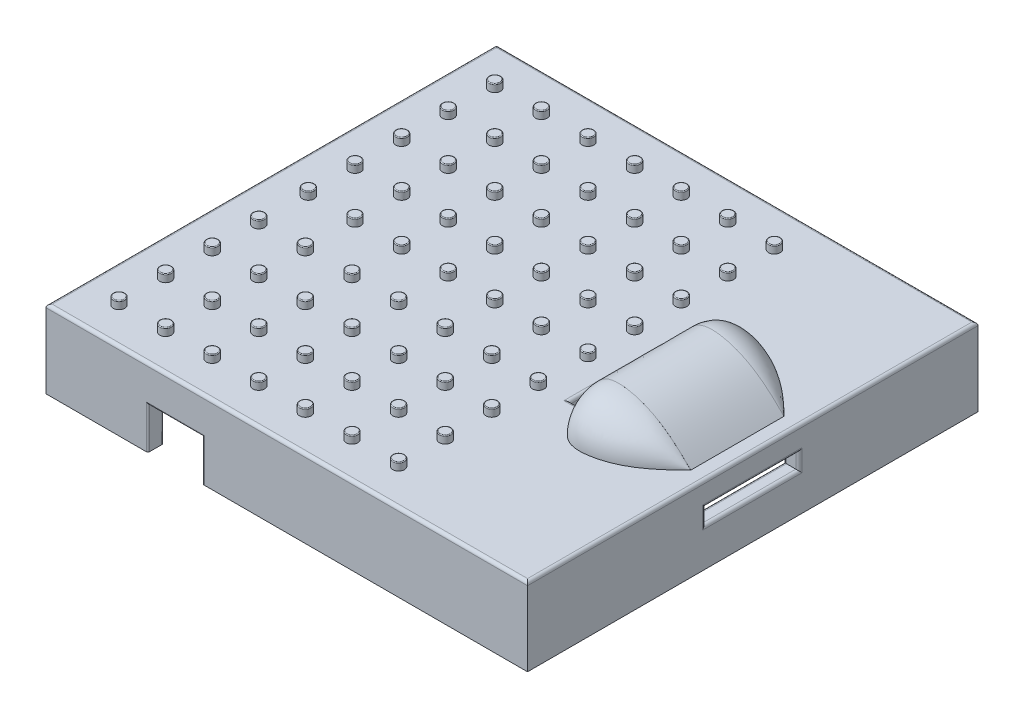
from build123d import *

# Parameters (mm, degrees)
SKETCH1_W           = 310
SKETCH1_H           = 290
BOSS_EXTRUDE1_DEPTH = 50
CUT_EXTRUDE3_DEPTH  = 40
BOSS_EXTRUDE3_START = -30
BOSS_EXTRUDE3_DEPTH = 60
REVOLVE9_ANGLE      = 90
REVOLVE10_ANGLE     = 90
SKETCH18_R          = 3.745
BOSS_EXTRUDE4_DEPTH = 4.9
FILLET3_R           = 0.5
FILLET9_R           = 2
CUT_EXTRUDE9_DEPTH  = 10
FILLET14_R          = 2
CUT_EXTRUDE10_DEPTH = 10
FILLET15_R          = 2
CUT_EXTRUDE11_START = -145
SKETCH21_W          = 35.224793961
SKETCH21_H          = 26.773914636
CUT_EXTRUDE11_DEPTH = 290
FILLET17_R          = 1


with BuildPart() as part:
    # Sketch1 → Boss-Extrude1 (new body)
    with BuildSketch(Plane(origin=(0, 0, 0), x_dir=(1, 0, 0), z_dir=(0, 1, 0))):
        Rectangle(SKETCH1_W, SKETCH1_H)
    extrude(amount=-BOSS_EXTRUDE1_DEPTH)

    # 3DSketch1 → Cut-Extrude3 (cut)
    with BuildSketch(Plane(origin=(145, -50, -135), x_dir=(-0.7318939744313497, 0, 0.6814185279188429), z_dir=(0, 1, 0))):
        Polygon((0, 0), (212.249252585, -197.611373096), (396.232255123, 0), (183.983002538, 197.611373096), align=None)
    extrude(amount=CUT_EXTRUDE3_DEPTH, mode=Mode.SUBTRACT)

    # Sketch3 → Boss-Extrude3 (add)
    with BuildSketch(Plane.XY.offset(BOSS_EXTRUDE3_START)):
        with BuildLine():
            Line((77.586962215, 0), (145.086962215, 0))
            add(Edge.make_bspline(
                [(77.586962215, 0), (84.732827695, 42.270472868), (108.196356269, 16.1555996), (113.544446998, 32.608859531), (145.086962215, 0)],
                knots=[0, 0, 0, 0, 0, 1, 1, 1, 1, 1], degree=4))
        make_face()
    extrude(amount=BOSS_EXTRUDE3_DEPTH)

    # Sketch16 → Revolve9 (revolve)
    with BuildSketch(Plane.XY.offset(30)):
        with BuildLine():
            Line((77.5, 0), (145, 0))
            add(Edge.make_bspline(
                [(77.5, 0), (84.732827695, 42.270472868), (108.196356269, 16.1555996), (113.544446998, 32.608859531), (145, 0)],
                knots=[0, 0, 0, 0, 0, 1, 1, 1, 1, 1], degree=4))
        make_face()
    revolve(axis=Axis((77.586962215, 0, 30), (1, 0, 0)), revolution_arc=REVOLVE9_ANGLE)

    # Sketch17 → Revolve10 (revolve)
    with BuildSketch(Plane.XY.offset(-30)):
        with BuildLine():
            Line((77.5, 0), (145, 0))
            add(Edge.make_bspline(
                [(77.5, 0), (84.732827695, 42.270472868), (108.196356269, 16.1555996), (113.544446998, 32.608859531), (145, 0)],
                knots=[0, 0, 0, 0, 0, 1, 1, 1, 1, 1], degree=4))
        make_face()
    revolve(axis=Axis((77.586962215, 0, -30), (-1, 0, 0)), revolution_arc=REVOLVE10_ANGLE)

    # Sketch18 → Boss-Extrude4 (add)
    with BuildSketch(Plane(origin=(0, 0, 0), x_dir=(1, 0, 0), z_dir=(0, 1, 0))):
        with Locations(Location((-131.067130765, 90, 0), (0, 0, 90))):
            Circle(SKETCH18_R)
        with Locations(Location((-131.067130765, 60, 0), (0, 0, 90))):
            Circle(SKETCH18_R)
        with Locations(Location((-131.067130765, 30, 0), (0, 0, 90))):
            Circle(SKETCH18_R)
        with Locations(Location((-131.067130765, 0, 0), (0, 0, 90))):
            Circle(SKETCH18_R)
        with Locations(Location((-131.067130765, -31.933169579, 0), (0, 0, 90))):
            Circle(SKETCH18_R)
        with Locations(Location((-131.067130765, -61.933169579, 0), (0, 0, 90))):
            Circle(SKETCH18_R)
        with Locations(Location((-131.067130765, -91.933169579, 0), (0, 0, 90))):
            Circle(SKETCH18_R)
        with Locations(Location((-101.067130765, 90, 0), (0, 0, 90))):
            Circle(SKETCH18_R)
        with Locations(Location((-101.067130765, 60, 0), (0, 0, 90))):
            Circle(SKETCH18_R)
        with Locations(Location((-101.067130765, 30, 0), (0, 0, 90))):
            Circle(SKETCH18_R)
        with Locations(Location((-101.067130765, 0, 0), (0, 0, 90))):
            Circle(SKETCH18_R)
        with Locations(Location((-101.067130765, -31.933169579, 0), (0, 0, 90))):
            Circle(SKETCH18_R)
        with Locations(Location((-101.067130765, -61.933169579, 0), (0, 0, 90))):
            Circle(SKETCH18_R)
        with Locations(Location((-101.067130765, -91.933169579, 0), (0, 0, 90))):
            Circle(SKETCH18_R)
        with Locations(Location((-71.067130765, 90, 0), (0, 0, 90))):
            Circle(SKETCH18_R)
        with Locations(Location((-71.067130765, 60, 0), (0, 0, 90))):
            Circle(SKETCH18_R)
        with Locations(Location((-71.067130765, 30, 0), (0, 0, 90))):
            Circle(SKETCH18_R)
        with Locations(Location((-71.067130765, 0, 0), (0, 0, 90))):
            Circle(SKETCH18_R)
        with Locations(Location((-71.067130765, -31.933169579, 0), (0, 0, 90))):
            Circle(SKETCH18_R)
        with Locations(Location((-71.067130765, -61.933169579, 0), (0, 0, 90))):
            Circle(SKETCH18_R)
        with Locations(Location((-71.067130765, -91.933169579, 0), (0, 0, 90))):
            Circle(SKETCH18_R)
        with Locations(Location((-41.067130765, 90, 0), (0, 0, 90))):
            Circle(SKETCH18_R)
        with Locations(Location((-41.067130765, 60, 0), (0, 0, 90))):
            Circle(SKETCH18_R)
        with Locations(Location((-41.067130765, 30, 0), (0, 0, 90))):
            Circle(SKETCH18_R)
        with Locations(Location((-41.067130765, 0, 0), (0, 0, 90))):
            Circle(SKETCH18_R)
        with Locations(Location((-41.067130765, -31.933169579, 0), (0, 0, 90))):
            Circle(SKETCH18_R)
        with Locations(Location((-41.067130765, -61.933169579, 0), (0, 0, 90))):
            Circle(SKETCH18_R)
        with Locations(Location((-41.067130765, -91.933169579, 0), (0, 0, 90))):
            Circle(SKETCH18_R)
        with Locations(Location((48.932869235, 90, 0), (0, 0, 90))):
            Circle(SKETCH18_R)
        with Locations(Location((48.932869235, 60, 0), (0, 0, 90))):
            Circle(SKETCH18_R)
        with Locations(Location((48.932869235, 30, 0), (0, 0, 90))):
            Circle(SKETCH18_R)
        with Locations(Location((-11.067130765, 90, 0), (0, 0, 90))):
            Circle(SKETCH18_R)
        with Locations(Location((-11.067130765, 60, 0), (0, 0, 90))):
            Circle(SKETCH18_R)
        with Locations(Location((-11.067130765, 30, 0), (0, 0, 90))):
            Circle(SKETCH18_R)
        with Locations(Location((-11.067130765, 0, 0), (0, 0, 90))):
            Circle(SKETCH18_R)
        with Locations(Location((-11.067130765, -31.933169579, 0), (0, 0, 90))):
            Circle(SKETCH18_R)
        with Locations(Location((-11.067130765, -61.933169579, 0), (0, 0, 90))):
            Circle(SKETCH18_R)
        with Locations(Location((-11.067130765, -91.933169579, 0), (0, 0, 90))):
            Circle(SKETCH18_R)
        with Locations(Location((48.932869235, 0, 0), (0, 0, 90))):
            Circle(SKETCH18_R)
        with Locations(Location((48.932869235, -31.933169579, 0), (0, 0, 90))):
            Circle(SKETCH18_R)
        with Locations(Location((48.932869235, -61.933169579, 0), (0, 0, 90))):
            Circle(SKETCH18_R)
        with Locations(Location((48.932869235, -91.933169579, 0), (0, 0, 90))):
            Circle(SKETCH18_R)
        with Locations(Location((18.932869235, 90, 0), (0, 0, 90))):
            Circle(SKETCH18_R)
        with Locations(Location((18.932869235, 60, 0), (0, 0, 90))):
            Circle(SKETCH18_R)
        with Locations(Location((18.932869235, 30, 0), (0, 0, 90))):
            Circle(SKETCH18_R)
        with Locations(Location((18.932869235, 0, 0), (0, 0, 90))):
            Circle(SKETCH18_R)
        with Locations(Location((18.932869235, -31.933169579, 0), (0, 0, 90))):
            Circle(SKETCH18_R)
        with Locations(Location((18.932869235, -61.933169579, 0), (0, 0, 90))):
            Circle(SKETCH18_R)
        with Locations(Location((18.932869235, -91.933169579, 0), (0, 0, 90))):
            Circle(SKETCH18_R)
        with Locations(Location((-131.067130765, 120, 0), (0, 0, 90))):
            Circle(SKETCH18_R)
        with Locations(Location((-101.067130765, 120, 0), (0, 0, 90))):
            Circle(SKETCH18_R)
        with Locations(Location((-71.067130765, 120, 0), (0, 0, 90))):
            Circle(SKETCH18_R)
        with Locations(Location((-41.067130765, 120, 0), (0, 0, 90))):
            Circle(SKETCH18_R)
        with Locations(Location((48.932869235, 120, 0), (0, 0, 90))):
            Circle(SKETCH18_R)
        with Locations(Location((-11.067130765, 120, 0), (0, 0, 90))):
            Circle(SKETCH18_R)
        with Locations(Location((18.932869235, 120, 0), (0, 0, 90))):
            Circle(SKETCH18_R)
        with Locations(Location((-131.067130765, -121.933169579, 0), (0, 0, 90))):
            Circle(SKETCH18_R)
        with Locations(Location((-101.067130765, -121.933169579, 0), (0, 0, 90))):
            Circle(SKETCH18_R)
        with Locations(Location((-71.067130765, -121.933169579, 0), (0, 0, 90))):
            Circle(SKETCH18_R)
        with Locations(Location((-41.067130765, -121.933169579, 0), (0, 0, 90))):
            Circle(SKETCH18_R)
        with Locations(Location((48.932869235, -121.933169579, 0), (0, 0, 90))):
            Circle(SKETCH18_R)
        with Locations(Location((-11.067130765, -121.933169579, 0), (0, 0, 90))):
            Circle(SKETCH18_R)
        with Locations(Location((18.932869235, -121.933169579, 0), (0, 0, 90))):
            Circle(SKETCH18_R)
    extrude(amount=BOSS_EXTRUDE4_DEPTH)

    # Fillet3
    fillet3_edges = [part.edges().sort_by_distance(p)[0] for p in [
        (-131.067130765, 4.9, -86.255),
        (-131.067130765, 4.9, -56.255),
        (-131.067130765, 4.9, -26.255),
        (-131.067130765, 4.9, 3.745),
        (-131.067130765, 4.9, 35.678169579),
        (-131.067130765, 4.9, 65.678169579),
        (-131.067130765, 4.9, 95.678169579),
        (-101.067130765, 4.9, -86.255),
        (-101.067130765, 4.9, -56.255),
        (-101.067130765, 4.9, -26.255),
        (-101.067130765, 4.9, 3.745),
        (-101.067130765, 4.9, 35.678169579),
        (-101.067130765, 4.9, 65.678169579),
        (-101.067130765, 4.9, 95.678169579),
        (-71.067130765, 4.9, -86.255),
        (-71.067130765, 4.9, -56.255),
        (-71.067130765, 4.9, -26.255),
        (-71.067130765, 4.9, 3.745),
        (-71.067130765, 4.9, 35.678169579),
        (-71.067130765, 4.9, 65.678169579),
        (-71.067130765, 4.9, 95.678169579),
        (-41.067130765, 4.9, -86.255),
        (-41.067130765, 4.9, -56.255),
        (-41.067130765, 4.9, -26.255),
        (-41.067130765, 4.9, 3.745),
        (-41.067130765, 4.9, 35.678169579),
        (-41.067130765, 4.9, 65.678169579),
        (-41.067130765, 4.9, 95.678169579),
        (48.932869235, 4.9, -86.255),
        (48.932869235, 4.9, -56.255),
        (48.932869235, 4.9, -26.255),
        (-11.067130765, 4.9, -86.255),
        (-11.067130765, 4.9, -56.255),
        (-11.067130765, 4.9, -26.255),
        (-11.067130765, 4.9, 3.745),
        (-11.067130765, 4.9, 35.678169579),
        (-11.067130765, 4.9, 65.678169579),
        (-11.067130765, 4.9, 95.678169579),
        (48.932869235, 4.9, 3.745),
        (48.932869235, 4.9, 35.678169579),
        (48.932869235, 4.9, 65.678169579),
        (48.932869235, 4.9, 95.678169579),
        (18.932869235, 4.9, -86.255),
        (18.932869235, 4.9, -56.255),
        (18.932869235, 4.9, -26.255),
        (18.932869235, 4.9, 3.745),
        (18.932869235, 4.9, 35.678169579),
        (18.932869235, 4.9, 65.678169579),
        (18.932869235, 4.9, 95.678169579),
        (-131.067130765, 4.9, -116.255),
        (-101.067130765, 4.9, -116.255),
        (-71.067130765, 4.9, -116.255),
        (-41.067130765, 4.9, -116.255),
        (48.932869235, 4.9, -116.255),
        (-11.067130765, 4.9, -116.255),
        (18.932869235, 4.9, -116.255),
        (-131.067130765, 4.9, 125.678169579),
        (-101.067130765, 4.9, 125.678169579),
        (-71.067130765, 4.9, 125.678169579),
        (-41.067130765, 4.9, 125.678169579),
        (48.932869235, 4.9, 125.678169579),
        (-11.067130765, 4.9, 125.678169579),
        (18.932869235, 4.9, 125.678169579),
    ]]
    fillet(fillet3_edges, radius=FILLET3_R)

    # Fillet9
    fillet9_edges = [part.edges().sort_by_distance(p)[0] for p in [
        (0, 0, 145),
        (-155, 0, 0),
        (0, 0, -145),
        (155, 0, 0),
    ]]
    fillet(fillet9_edges, radius=FILLET9_R)

    # Sketch20 → Cut-Extrude9 (cut)
    with BuildSketch(Plane(origin=(0, 0, 0), x_dir=(1, 0, 0), z_dir=(0, 1, 0))):
        Polygon((77.5, 30), (67.5, 30), (67.5, -30.127847173), (77.5, -30), align=None)
    extrude(amount=-CUT_EXTRUDE9_DEPTH, mode=Mode.SUBTRACT)

    # Fillet14
    # the kernel refuses this fillet: 2 mm, written as the material it takes off along each edge
    with BuildSketch(Plane(origin=(77.5, -10, 35), x_dir=(0, 1, 0), z_dir=(0, 0, -1))) as fillet14_piece_1_section:
        with BuildLine():
            CenterArc((FILLET14_R, FILLET14_R), FILLET14_R, 180, 90)
            Line((0, FILLET14_R), (-FILLET14_R * 0.02, FILLET14_R))
            Line((-FILLET14_R * 0.02, FILLET14_R), (-FILLET14_R * 0.02, -FILLET14_R * 0.02))
            Line((-FILLET14_R * 0.02, -FILLET14_R * 0.02), (FILLET14_R, -FILLET14_R * 0.02))
            Line((FILLET14_R, -FILLET14_R * 0.02), (FILLET14_R, 0))
        make_face()
    fillet14_piece_1 = extrude(amount=65, mode=Mode.PRIVATE)
    fillet14_piece_1 = split(fillet14_piece_1, bisect_by=Plane(origin=(78.336192456, -9.547186367, 29.989309516), z_dir=(-0.012783672553535347, 0, -0.9999182855193939)), keep=Keep.TOP, mode=Mode.PRIVATE)
    add(fillet14_piece_1, mode=Mode.SUBTRACT)
    with BuildSketch(Plane(origin=(62.500408572, -10, 30.191765535), x_dir=(0, 1, 0), z_dir=(0.9999182855193939, 0, -0.012783672553535347))) as fillet14_piece_2_section:
        with BuildLine():
            CenterArc((FILLET14_R, FILLET14_R), FILLET14_R, 180, 90)
            Line((0, FILLET14_R), (-FILLET14_R * 0.02, FILLET14_R))
            Line((-FILLET14_R * 0.02, FILLET14_R), (-FILLET14_R * 0.02, -FILLET14_R * 0.02))
            Line((-FILLET14_R * 0.02, -FILLET14_R * 0.02), (FILLET14_R, -FILLET14_R * 0.02))
            Line((FILLET14_R, -FILLET14_R * 0.02), (FILLET14_R, 0))
        make_face()
    fillet14_piece_2 = extrude(amount=20.000817212, mode=Mode.PRIVATE)
    fillet14_piece_2 = split(fillet14_piece_2, bisect_by=Plane(origin=(67.5, -9.547209771, 30.516750817), z_dir=(1, 0, 0)), keep=Keep.TOP, mode=Mode.PRIVATE)
    fillet14_piece_2 = split(fillet14_piece_2, bisect_by=Plane(origin=(77.5, -9.547209771, 30.516750817), z_dir=(-1, 0, 0)), keep=Keep.TOP, mode=Mode.PRIVATE)
    add(fillet14_piece_2, mode=Mode.SUBTRACT)
    with BuildSketch(Plane(origin=(67.5, -10, -30), x_dir=(0, 1, 0), z_dir=(0, 0, 1))) as fillet14_piece_3_section:
        with BuildLine():
            CenterArc((FILLET14_R, FILLET14_R), FILLET14_R, 180, 90)
            Line((0, FILLET14_R), (-FILLET14_R * 0.02, FILLET14_R))
            Line((-FILLET14_R * 0.02, FILLET14_R), (-FILLET14_R * 0.02, -FILLET14_R * 0.02))
            Line((-FILLET14_R * 0.02, -FILLET14_R * 0.02), (FILLET14_R, -FILLET14_R * 0.02))
            Line((FILLET14_R, -FILLET14_R * 0.02), (FILLET14_R, 0))
        make_face()
    fillet14_piece_3 = extrude(amount=65.127847173, mode=Mode.PRIVATE)
    fillet14_piece_3 = split(fillet14_piece_3, bisect_by=Plane(origin=(67.431503198, -9.547233121, 30.128722885), z_dir=(-0.012783672553535347, 0, -0.9999182855193939)), keep=Keep.TOP, mode=Mode.PRIVATE)
    add(fillet14_piece_3, mode=Mode.SUBTRACT)
    with BuildSketch(Plane(origin=(77.5, -10, -30), x_dir=(0, 1, 0), z_dir=(-1, 0, 0)), Plane(origin=(77.5, 0, -30), x_dir=(0, 0, -1), z_dir=(-1, 0, 0))) as fillet14_piece_4:
        with BuildLine():
            CenterArc((FILLET14_R, FILLET14_R), FILLET14_R, 180, 90)
            Line((0, FILLET14_R), (-FILLET14_R * 0.02, FILLET14_R))
            Line((-FILLET14_R * 0.02, FILLET14_R), (-FILLET14_R * 0.02, -FILLET14_R * 0.02))
            Line((-FILLET14_R * 0.02, -FILLET14_R * 0.02), (FILLET14_R, -FILLET14_R * 0.02))
            Line((FILLET14_R, -FILLET14_R * 0.02), (FILLET14_R, 0))
        make_face()
    extrude(amount=10, mode=Mode.SUBTRACT)
    with BuildSketch(Plane(origin=(67.5, 0, -30), x_dir=(-1, 0, 0), z_dir=(0, 0, 1))) as fillet14_piece_5_section:
        with BuildLine():
            CenterArc((FILLET14_R, FILLET14_R), FILLET14_R, 180, 90)
            Line((0, FILLET14_R), (-FILLET14_R * 0.02, FILLET14_R))
            Line((-FILLET14_R * 0.02, FILLET14_R), (-FILLET14_R * 0.02, -FILLET14_R * 0.02))
            Line((-FILLET14_R * 0.02, -FILLET14_R * 0.02), (FILLET14_R, -FILLET14_R * 0.02))
            Line((FILLET14_R, -FILLET14_R * 0.02), (FILLET14_R, 0))
        make_face()
    fillet14_piece_5 = extrude(amount=65.127847173, mode=Mode.PRIVATE)
    fillet14_piece_5 = split(fillet14_piece_5, bisect_by=Plane(origin=(67.431503198, -0.452766879, 30.128722885), z_dir=(-0.012783672553535347, 0, -0.9999182855193939)), keep=Keep.TOP, mode=Mode.PRIVATE)
    add(fillet14_piece_5, mode=Mode.SUBTRACT)
    with BuildSketch(Plane(origin=(62.500408572, 0, 30.191765535), x_dir=(0.012783672553535345, 0, 0.9999182855193938), z_dir=(0.9999182855193939, 0, -0.012783672553535347))) as fillet14_piece_6_section:
        with BuildLine():
            CenterArc((FILLET14_R, FILLET14_R), FILLET14_R, 180, 90)
            Line((0, FILLET14_R), (-FILLET14_R * 0.02, FILLET14_R))
            Line((-FILLET14_R * 0.02, FILLET14_R), (-FILLET14_R * 0.02, -FILLET14_R * 0.02))
            Line((-FILLET14_R * 0.02, -FILLET14_R * 0.02), (FILLET14_R, -FILLET14_R * 0.02))
            Line((FILLET14_R, -FILLET14_R * 0.02), (FILLET14_R, 0))
        make_face()
    fillet14_piece_6 = extrude(amount=20.000817212, mode=Mode.PRIVATE)
    fillet14_piece_6 = split(fillet14_piece_6, bisect_by=Plane(origin=(67.5, -0.446108104, 30.523469387), z_dir=(1, 0, 0)), keep=Keep.TOP, mode=Mode.PRIVATE)
    fillet14_piece_6 = split(fillet14_piece_6, bisect_by=Plane(origin=(77.5, -0.446108104, 30.523469387), z_dir=(-1, 0, 0)), keep=Keep.TOP, mode=Mode.PRIVATE)
    fillet14_piece_6 = split(fillet14_piece_6, bisect_by=Plane(origin=(72.449846937, -0.446108104, 30), z_dir=(0, 0, 1)), keep=Keep.TOP, mode=Mode.PRIVATE)
    add(fillet14_piece_6, mode=Mode.SUBTRACT)
    with BuildSketch(Plane(origin=(62.500408572, -10, 30.191765535), x_dir=(0, 1, 0), z_dir=(0.9999182855193939, 0, -0.012783672553535347))) as fillet14_piece_7a_section:
        with BuildLine():
            CenterArc((FILLET14_R, FILLET14_R), FILLET14_R, 180, 90)
            Line((0, FILLET14_R), (-FILLET14_R * 0.02, FILLET14_R))
            Line((-FILLET14_R * 0.02, FILLET14_R), (-FILLET14_R * 0.02, -FILLET14_R * 0.02))
            Line((-FILLET14_R * 0.02, -FILLET14_R * 0.02), (FILLET14_R, -FILLET14_R * 0.02))
            Line((FILLET14_R, -FILLET14_R * 0.02), (FILLET14_R, 0))
        make_face()
    fillet14_piece_7a = extrude(amount=20.000817212, mode=Mode.PRIVATE)
    fillet14_piece_7a = split(fillet14_piece_7a, bisect_by=Plane(origin=(77.5, -9.547490267, 30.421305851), z_dir=(1, 0, 0)), keep=Keep.TOP, mode=Mode.PRIVATE)
    with BuildSketch(Plane(origin=(77.5, -10, 35), x_dir=(0, 1, 0), z_dir=(0, 0, -1))) as fillet14_piece_7b_section:
        with BuildLine():
            CenterArc((FILLET14_R, FILLET14_R), FILLET14_R, 180, 90)
            Line((0, FILLET14_R), (-FILLET14_R * 0.02, FILLET14_R))
            Line((-FILLET14_R * 0.02, FILLET14_R), (-FILLET14_R * 0.02, -FILLET14_R * 0.02))
            Line((-FILLET14_R * 0.02, -FILLET14_R * 0.02), (FILLET14_R, -FILLET14_R * 0.02))
            Line((FILLET14_R, -FILLET14_R * 0.02), (FILLET14_R, 0))
        make_face()
    fillet14_piece_7b = extrude(amount=65, mode=Mode.PRIVATE)
    fillet14_piece_7b = split(fillet14_piece_7b, bisect_by=Plane(origin=(77.921271424, -9.547490267, 29.994614164), z_dir=(0.012783672553535347, 0, 0.9999182855193939)), keep=Keep.TOP, mode=Mode.PRIVATE)
    fillet14_piece_7 = fillet14_piece_7a & fillet14_piece_7b
    add(fillet14_piece_7, mode=Mode.SUBTRACT)
    with BuildSketch(Plane(origin=(82.5, -10, -30), x_dir=(0, 1, 0), z_dir=(-1, 0, 0))) as fillet14_piece_8a_section:
        with BuildLine():
            CenterArc((FILLET14_R, FILLET14_R), FILLET14_R, 180, 90)
            Line((0, FILLET14_R), (-FILLET14_R * 0.02, FILLET14_R))
            Line((-FILLET14_R * 0.02, FILLET14_R), (-FILLET14_R * 0.02, -FILLET14_R * 0.02))
            Line((-FILLET14_R * 0.02, -FILLET14_R * 0.02), (FILLET14_R, -FILLET14_R * 0.02))
            Line((FILLET14_R, -FILLET14_R * 0.02), (FILLET14_R, 0))
        make_face()
    fillet14_piece_8a = extrude(amount=15, mode=Mode.PRIVATE)
    fillet14_piece_8a = split(fillet14_piece_8a, bisect_by=Plane(origin=(77.5, -9.547209771, -30.452790229), z_dir=(1, 0, 0)), keep=Keep.TOP, mode=Mode.PRIVATE)
    with BuildSketch(Plane(origin=(77.5, -10, 35), x_dir=(0, 1, 0), z_dir=(0, 0, -1))) as fillet14_piece_8b_section:
        with BuildLine():
            CenterArc((FILLET14_R, FILLET14_R), FILLET14_R, 180, 90)
            Line((0, FILLET14_R), (-FILLET14_R * 0.02, FILLET14_R))
            Line((-FILLET14_R * 0.02, FILLET14_R), (-FILLET14_R * 0.02, -FILLET14_R * 0.02))
            Line((-FILLET14_R * 0.02, -FILLET14_R * 0.02), (FILLET14_R, -FILLET14_R * 0.02))
            Line((FILLET14_R, -FILLET14_R * 0.02), (FILLET14_R, 0))
        make_face()
    fillet14_piece_8b = extrude(amount=70, mode=Mode.PRIVATE)
    fillet14_piece_8b = split(fillet14_piece_8b, bisect_by=Plane(origin=(77.952790229, -9.547209771, -30), z_dir=(0, 0, -1)), keep=Keep.TOP, mode=Mode.PRIVATE)
    fillet14_piece_8 = fillet14_piece_8a & fillet14_piece_8b
    add(fillet14_piece_8, mode=Mode.SUBTRACT)
    with BuildSketch(Plane(origin=(67.5, -10, -30), x_dir=(0, 1, 0), z_dir=(0, 0, 1))) as fillet14_piece_9a_section:
        with BuildLine():
            CenterArc((FILLET14_R, FILLET14_R), FILLET14_R, 180, 90)
            Line((0, FILLET14_R), (-FILLET14_R * 0.02, FILLET14_R))
            Line((-FILLET14_R * 0.02, FILLET14_R), (-FILLET14_R * 0.02, -FILLET14_R * 0.02))
            Line((-FILLET14_R * 0.02, -FILLET14_R * 0.02), (FILLET14_R, -FILLET14_R * 0.02))
            Line((FILLET14_R, -FILLET14_R * 0.02), (FILLET14_R, 0))
        make_face()
    fillet14_piece_9a = extrude(amount=65.127847173, mode=Mode.PRIVATE)
    fillet14_piece_9a = split(fillet14_piece_9a, bisect_by=Plane(origin=(67.015766064, -9.546928625, 30.134037966), z_dir=(0.012783672553535347, 0, 0.9999182855193939)), keep=Keep.TOP, mode=Mode.PRIVATE)
    with BuildSketch(Plane(origin=(62.500408572, -10, 30.191765535), x_dir=(0, 1, 0), z_dir=(0.9999182855193939, 0, -0.012783672553535347))) as fillet14_piece_9b_section:
        with BuildLine():
            CenterArc((FILLET14_R, FILLET14_R), FILLET14_R, 180, 90)
            Line((0, FILLET14_R), (-FILLET14_R * 0.02, FILLET14_R))
            Line((-FILLET14_R * 0.02, FILLET14_R), (-FILLET14_R * 0.02, -FILLET14_R * 0.02))
            Line((-FILLET14_R * 0.02, -FILLET14_R * 0.02), (FILLET14_R, -FILLET14_R * 0.02))
            Line((FILLET14_R, -FILLET14_R * 0.02), (FILLET14_R, 0))
        make_face()
    fillet14_piece_9b = extrude(amount=20.000817212, mode=Mode.PRIVATE)
    fillet14_piece_9b = split(fillet14_piece_9b, bisect_by=Plane(origin=(67.5, -9.546928625, 30.612120681), z_dir=(-1, 0, 0)), keep=Keep.TOP, mode=Mode.PRIVATE)
    fillet14_piece_9 = fillet14_piece_9a & fillet14_piece_9b
    add(fillet14_piece_9, mode=Mode.SUBTRACT)
    with BuildSketch(Plane(origin=(77.5, -10, -30), x_dir=(0, 1, 0), z_dir=(-1, 0, 0))) as fillet14_piece_10a_section:
        with BuildLine():
            CenterArc((FILLET14_R, FILLET14_R), FILLET14_R, 180, 90)
            Line((0, FILLET14_R), (-FILLET14_R * 0.02, FILLET14_R))
            Line((-FILLET14_R * 0.02, FILLET14_R), (-FILLET14_R * 0.02, -FILLET14_R * 0.02))
            Line((-FILLET14_R * 0.02, -FILLET14_R * 0.02), (FILLET14_R, -FILLET14_R * 0.02))
            Line((FILLET14_R, -FILLET14_R * 0.02), (FILLET14_R, 0))
        make_face()
    fillet14_piece_10a = extrude(amount=15, mode=Mode.PRIVATE)
    fillet14_piece_10a = split(fillet14_piece_10a, bisect_by=Plane(origin=(67.5, -9.547209771, -30.452790229), z_dir=(-1, 0, 0)), keep=Keep.TOP, mode=Mode.PRIVATE)
    with BuildSketch(Plane(origin=(67.5, -10, -35), x_dir=(0, 1, 0), z_dir=(0, 0, 1))) as fillet14_piece_10b_section:
        with BuildLine():
            CenterArc((FILLET14_R, FILLET14_R), FILLET14_R, 180, 90)
            Line((0, FILLET14_R), (-FILLET14_R * 0.02, FILLET14_R))
            Line((-FILLET14_R * 0.02, FILLET14_R), (-FILLET14_R * 0.02, -FILLET14_R * 0.02))
            Line((-FILLET14_R * 0.02, -FILLET14_R * 0.02), (FILLET14_R, -FILLET14_R * 0.02))
            Line((FILLET14_R, -FILLET14_R * 0.02), (FILLET14_R, 0))
        make_face()
    fillet14_piece_10b = extrude(amount=70.127847173, mode=Mode.PRIVATE)
    fillet14_piece_10b = split(fillet14_piece_10b, bisect_by=Plane(origin=(67.047209771, -9.547209771, -30), z_dir=(0, 0, -1)), keep=Keep.TOP, mode=Mode.PRIVATE)
    fillet14_piece_10 = fillet14_piece_10a & fillet14_piece_10b
    add(fillet14_piece_10, mode=Mode.SUBTRACT)
    with BuildSketch(Plane(origin=(77.5, 0, -30), x_dir=(0, 0, -1), z_dir=(-1, 0, 0))) as fillet14_piece_11a_section:
        with BuildLine():
            CenterArc((FILLET14_R, FILLET14_R), FILLET14_R, 180, 90)
            Line((0, FILLET14_R), (-FILLET14_R * 0.02, FILLET14_R))
            Line((-FILLET14_R * 0.02, FILLET14_R), (-FILLET14_R * 0.02, -FILLET14_R * 0.02))
            Line((-FILLET14_R * 0.02, -FILLET14_R * 0.02), (FILLET14_R, -FILLET14_R * 0.02))
            Line((FILLET14_R, -FILLET14_R * 0.02), (FILLET14_R, 0))
        make_face()
    fillet14_piece_11a = extrude(amount=15, mode=Mode.PRIVATE)
    fillet14_piece_11a = split(fillet14_piece_11a, bisect_by=Plane(origin=(67.5, -0.452790229, -30.452790229), z_dir=(-1, 0, 0)), keep=Keep.TOP, mode=Mode.PRIVATE)
    with BuildSketch(Plane(origin=(67.5, 0, -35), x_dir=(-1, 0, 0), z_dir=(0, 0, 1))) as fillet14_piece_11b_section:
        with BuildLine():
            CenterArc((FILLET14_R, FILLET14_R), FILLET14_R, 180, 90)
            Line((0, FILLET14_R), (-FILLET14_R * 0.02, FILLET14_R))
            Line((-FILLET14_R * 0.02, FILLET14_R), (-FILLET14_R * 0.02, -FILLET14_R * 0.02))
            Line((-FILLET14_R * 0.02, -FILLET14_R * 0.02), (FILLET14_R, -FILLET14_R * 0.02))
            Line((FILLET14_R, -FILLET14_R * 0.02), (FILLET14_R, 0))
        make_face()
    fillet14_piece_11b = extrude(amount=70.127847173, mode=Mode.PRIVATE)
    fillet14_piece_11b = split(fillet14_piece_11b, bisect_by=Plane(origin=(67.047209771, -0.452790229, -30), z_dir=(0, 0, -1)), keep=Keep.TOP, mode=Mode.PRIVATE)
    fillet14_piece_11 = fillet14_piece_11a & fillet14_piece_11b
    add(fillet14_piece_11, mode=Mode.SUBTRACT)
    with BuildSketch(Plane(origin=(67.5, 0, -30), x_dir=(-1, 0, 0), z_dir=(0, 0, 1))) as fillet14_piece_12a_section:
        with BuildLine():
            CenterArc((FILLET14_R, FILLET14_R), FILLET14_R, 180, 90)
            Line((0, FILLET14_R), (-FILLET14_R * 0.02, FILLET14_R))
            Line((-FILLET14_R * 0.02, FILLET14_R), (-FILLET14_R * 0.02, -FILLET14_R * 0.02))
            Line((-FILLET14_R * 0.02, -FILLET14_R * 0.02), (FILLET14_R, -FILLET14_R * 0.02))
            Line((FILLET14_R, -FILLET14_R * 0.02), (FILLET14_R, 0))
        make_face()
    fillet14_piece_12a = extrude(amount=65.127847173, mode=Mode.PRIVATE)
    fillet14_piece_12a = split(fillet14_piece_12a, bisect_by=Plane(origin=(67.015766064, -0.453071375, 30.134037966), z_dir=(0.012783672553535347, 0, 0.9999182855193939)), keep=Keep.TOP, mode=Mode.PRIVATE)
    with BuildSketch(Plane(origin=(62.500408572, 0, 30.191765535), x_dir=(0.012783672553535345, 0, 0.9999182855193938), z_dir=(0.9999182855193939, 0, -0.012783672553535347))) as fillet14_piece_12b_section:
        with BuildLine():
            CenterArc((FILLET14_R, FILLET14_R), FILLET14_R, 180, 90)
            Line((0, FILLET14_R), (-FILLET14_R * 0.02, FILLET14_R))
            Line((-FILLET14_R * 0.02, FILLET14_R), (-FILLET14_R * 0.02, -FILLET14_R * 0.02))
            Line((-FILLET14_R * 0.02, -FILLET14_R * 0.02), (FILLET14_R, -FILLET14_R * 0.02))
            Line((FILLET14_R, -FILLET14_R * 0.02), (FILLET14_R, 0))
        make_face()
    fillet14_piece_12b = extrude(amount=20.000817212, mode=Mode.PRIVATE)
    fillet14_piece_12b = split(fillet14_piece_12b, bisect_by=Plane(origin=(67.5, -0.453071375, 30.612120681), z_dir=(-1, 0, 0)), keep=Keep.TOP, mode=Mode.PRIVATE)
    fillet14_piece_12 = fillet14_piece_12a & fillet14_piece_12b
    add(fillet14_piece_12, mode=Mode.SUBTRACT)

    # 3DSketch8 → Cut-Extrude10 (cut)
    with BuildSketch(Plane(origin=(155, -15.360688371, 30.283436909), x_dir=(0, -0.16439898730535724, -0.9863939238321437), z_dir=(-1, 0, 0))):
        Polygon((0, 0), (1.643989873, 9.863939238), (60.827625303, 0), (59.18363543, -9.863939238), align=None)
    extrude(amount=CUT_EXTRUDE10_DEPTH, mode=Mode.SUBTRACT)

    # Fillet15
    fillet15_edges = [part.edges().sort_by_distance(p)[0] for p in [
        (145, -20.360688371, -29.716563091),
        (145, -25.360688371, 0.283436909),
        (145, -15.360688371, 0.283436909),
        (145, -20.360688371, 30.283436909),
        (155, -20.360688371, -29.716563091),
        (155, -25.360688371, 0.283436909),
        (155, -20.360688371, 30.283436909),
        (155, -15.360688371, 0.283436909),
    ]]
    fillet(fillet15_edges, radius=FILLET15_R)

    # Sketch21 → Cut-Extrude11 (cut)
    with BuildSketch(Plane.XY.offset(CUT_EXTRUDE11_START)):
        with Locations((-71.770517695, -36.613042682)):
            Rectangle(SKETCH21_W, SKETCH21_H)
    extrude(amount=CUT_EXTRUDE11_DEPTH, mode=Mode.SUBTRACT)

    # Fillet17
    fillet17_edges = [part.edges().sort_by_distance(p)[0] for p in [
        (-89.382914675, -36.613042682, -145),
        (-89.382914675, -36.613042682, -135),
        (-54.158120714, -36.613042682, -135),
        (-54.158120714, -36.613042682, -145),
        (-71.770517694, -23.226085364, -145),
        (-71.770517694, -23.226085364, -135),
        (-89.382914675, -36.613042682, 135),
        (-54.158120714, -36.613042682, 135),
        (-71.770517694, -23.226085364, 135),
        (-54.158120714, -36.613042682, 145),
        (-89.382914675, -36.613042682, 145),
        (-71.770517694, -23.226085364, 145),
    ]]
    fillet(fillet17_edges, radius=FILLET17_R)


solid = part.part
